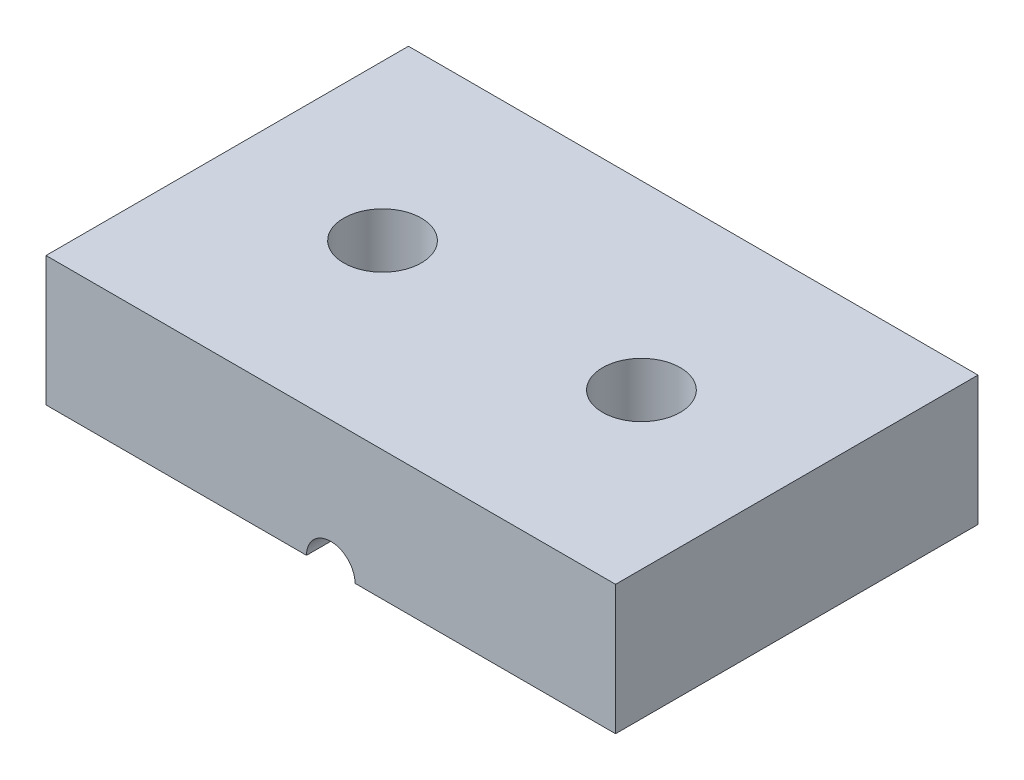
from build123d import *

# Parameters (mm, degrees)
SKETCH1_W                     = 8.8
SKETCH1_H                     = 5.6
BOSS_BODY_DEPTH               = 2
SKETCH2_R                     = 0.6
CUT_SCREW_THROUGH_HOLES_DEPTH = 11.620734438
SKETCH3_R                     = 0.375
CUT_CABLE_PASS_DEPTH          = 11.620734438


with BuildPart() as part:
    # Sketch1 → Boss-Body (new body)
    with BuildSketch(Plane(origin=(0, 0, 0), x_dir=(1, 0, 0), z_dir=(0, 1, 0))):
        with Locations((4.4, 2.8)):
            Rectangle(SKETCH1_W, SKETCH1_H)
    extrude(amount=BOSS_BODY_DEPTH)

    # Sketch2 → Cut-Screw Through Holes (cut, through all)
    with BuildSketch(Plane(origin=(0, 2, 0), x_dir=(1, 0, 0), z_dir=(0, 1, 0))):
        with Locations((2.4, 2.8)):
            Circle(SKETCH2_R)
        with Locations((6.4, 2.8)):
            Circle(SKETCH2_R)
    extrude(amount=-CUT_SCREW_THROUGH_HOLES_DEPTH, mode=Mode.SUBTRACT)

    # Sketch3 → Cut-Cable Pass (cut, through all)
    with BuildSketch(Plane.XY):
        with Locations((4.4, 0)):
            Circle(SKETCH3_R)
    extrude(amount=-CUT_CABLE_PASS_DEPTH, mode=Mode.SUBTRACT)


solid = part.part
